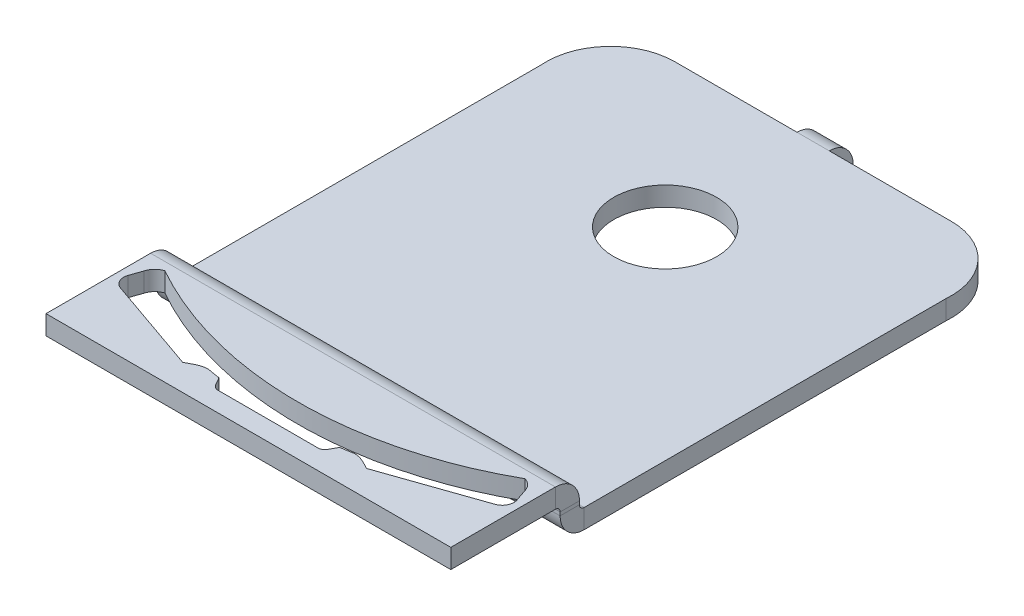
from build123d import *

# Parameters (mm, degrees)
BASE_FLANGE1_DEPTH           = 3
SKETCH2_R                    = 8
CUT_EXTRUDE1_DEPTH           = 73.112420355
EDGE_FLANGE1_STRIP_W         = 13.4732
EDGE_FLANGE1_STRIP_H         = 3
EDGE_FLANGE1_STRIP_CUT_DEPTH = 62.933077126
EDGE_FLANGE1_DEPTH           = 62.933077126
EDGE_FLANGE2_STRIP_W         = 13.4732
EDGE_FLANGE2_STRIP_H         = 3
EDGE_FLANGE2_STRIP_CUT_DEPTH = 62.933077126
EDGE_FLANGE2_DEPTH           = 62.933077126
CUT_EXTRUDE14_DEPTH          = 73.492766325
CUT_EXTRUDE15_DEPTH          = 73.492766325
CUT_EXTRUDE16_DEPTH          = 73.492766325
SKETCHED_START               = -2.498589927
SKETCHED_BEND2_DEPTH         = 5
SKETCHED_BEND2_2_DEPTH       = 5


# Read off the part's stored shape, not the designer's step: Sketched Bend2
# Sheet-metal steps are written as plain solids
with BuildPart() as part:
    # Sketch1 → Base-Flange1 (new body)
    with BuildSketch(Plane(origin=(0, 0, 0), x_dir=(1, 0, 0), z_dir=(0, 1, 0))):
        with BuildLine():
            Line((2.501410073, 64.8), (-2.498589927, 64.8))
            Line((-2.498589927, 64.8), (-2.498589927, 44.8))
            Line((-2.498589927, 44.8), (-21.498589927, 44.8))
            ThreePointArc((-21.498589927, 44.8), (-28.847059156, 41.582329983), (-31.466538563, 34))
            Line((-31.466538563, 34), (-31.466538563, -26))
            Line((-31.466538563, -26), (31.466538563, -26))
            Line((31.466538563, -26), (31.466538563, 34))
            ThreePointArc((31.466538563, 34), (28.848015597, 41.581293991), (21.501410073, 44.8))
            Line((21.501410073, 44.8), (2.501410073, 44.8))
            Line((2.501410073, 44.8), (2.501410073, 64.8))
        make_face()
    extrude(amount=-BASE_FLANGE1_DEPTH)

    # Sketch2 → Cut-Extrude1 (cut, through all)
    with BuildSketch(Plane(origin=(0, 0, 0), x_dir=(1, 0, 0), z_dir=(0, 1, 0))):
        with Locations(Location((0.000474376, 21.8, 0), (0, 0, 270))):
            Circle(SKETCH2_R)
    extrude(amount=-CUT_EXTRUDE1_DEPTH, mode=Mode.SUBTRACT)

    # Edge-Flange1 strip (across the edge) → Edge-Flange1 strip cut (cut)
    with BuildSketch(Plane(origin=(-31.466538563, 0, 26), x_dir=(0, 0, -1), z_dir=(1, 0, 0))):
        with Locations((-3, -1.5)):
            Rectangle(EDGE_FLANGE1_STRIP_W, EDGE_FLANGE1_STRIP_H)
    extrude(amount=EDGE_FLANGE1_STRIP_CUT_DEPTH, mode=Mode.SUBTRACT)

    # Edge-Flange1 section (across the edge) → Edge-Flange1 (add)
    with BuildSketch(Plane(origin=(-31.466538563, 0, 26), x_dir=(0, 0, -1), z_dir=(1, 0, 0))):
        with BuildLine():
            Line((0, 0.7366), (0, 2))
            Line((0, 2), (3, 2))
            Line((3, 2), (3, 0.7366))
            ThreePointArc((3, 0.7366), (3.215745145, 0.215745145), (3.7366, 0))
            Line((3.7366, 0), (3.7366, -3))
            ThreePointArc((3.7366, -3), (1.094424801, -1.905575199), (0, 0.7366))
        make_face()
    extrude(amount=EDGE_FLANGE1_DEPTH)

    # Edge-Flange2 strip (across the edge) → Edge-Flange2 strip cut (cut)
    with BuildSketch(Plane(origin=(31.466538563, 2, 26), x_dir=(0, -1, 0), z_dir=(-1, 0, 0))):
        with Locations((-6, -1.5)):
            Rectangle(EDGE_FLANGE2_STRIP_W, EDGE_FLANGE2_STRIP_H)
    extrude(amount=EDGE_FLANGE2_STRIP_CUT_DEPTH, mode=Mode.SUBTRACT)

    # Edge-Flange2 section (across the edge) → Edge-Flange2 (add)
    with BuildSketch(Plane(origin=(31.466538563, 2, 26), x_dir=(0, -1, 0), z_dir=(-1, 0, 0))):
        with BuildLine():
            Line((-3, 0.7366), (-3, 17))
            Line((-3, 17), (0, 17))
            Line((0, 17), (0, 0.7366))
            ThreePointArc((0, 0.7366), (0.215745145, 0.215745145), (0.7366, 0))
            Line((0.7366, 0), (0.7366, -3))
            ThreePointArc((0.7366, -3), (-1.905575199, -1.905575199), (-3, 0.7366))
        make_face()
    extrude(amount=EDGE_FLANGE2_DEPTH)

    # Sketch10 → Cut-Extrude14 (cut, through all)
    with BuildSketch(Plane(origin=(0, 5, 0), x_dir=(1, 0, 0), z_dir=(0, 1, 0))):
        with BuildLine():
            ThreePointArc((-27.999525624, -27.986488127), (-14.471973254, -33.456154948), (0, -35.319999998))
            ThreePointArc((0, -35.319999998), (14.472463109, -33.456275138), (28.000474376, -27.986488127))
            ThreePointArc((28.000474376, -27.986488127), (29.507543106, -29.356635577), (29.415737967, -31.391367011))
            ThreePointArc((29.415737967, -31.391367011), (26.522239798, -32.891637528), (23.552482739, -34.23465141))
            ThreePointArc((23.552482739, -34.23465141), (12.025251123, -37.723725926), (0.039934977, -38.908169509))
            ThreePointArc((0.039934977, -38.908169509), (-11.98559581, -37.731400069), (-23.551533984, -34.234651411))
            ThreePointArc((-23.551533984, -34.234651411), (-26.516212861, -32.894099815), (-29.404911166, -31.396828455))
            ThreePointArc((-29.404911166, -31.396828455), (-29.503369191, -29.361507737), (-27.999525624, -27.986488127))
        make_face()
    extrude(amount=-CUT_EXTRUDE14_DEPTH, mode=Mode.SUBTRACT)

    # Sketch12 → Cut-Extrude15 (cut, through all)
    with BuildSketch(Plane(origin=(0, 5, 0), x_dir=(1, 0, 0), z_dir=(0, 1, 0))):
        with BuildLine():
            add(Edge.make_bspline(
                [(-7.914237019, -39.945550294), (-8.841345223, -39.749796487), (-8.874121397, -38.753829984), (-9.426515507, -38.182603627)],
                knots=[0, 0, 0, 0, 0.911940572, 0.911940572, 0.911940572, 0.911940572], degree=3))
            Line((-7.914237019, -39.945550294), (0, -39.945550294))
            Line((0, -39.945550294), (0, -38.908175729))
            ThreePointArc((0, -38.908175729), (-4.727168745, -38.726119033), (-9.426515507, -38.182603627))
        make_face()
        with BuildLine():
            add(Edge.make_bspline(
                [(-9.426515507, -38.182603627), (-9.479856164, -38.127444478), (-9.538041922, -38.076245756), (-9.602345878, -38.030110388)],
                knots=[0.911940572, 0.911940572, 0.911940572, 0.911940572, 1, 1, 1, 1], degree=3))
            ThreePointArc((-9.426515507, -38.182603627), (-4.727168745, -38.726119033), (0, -38.908175729))
            Line((0, -38.908175729), (0, -38.030110388))
            Line((0, -38.030110388), (-9.602345878, -38.030110388))
        make_face()
        with BuildLine():
            Line((0, -38.030110388), (0, -38.908175729))
            ThreePointArc((0, -38.908175729), (0.019967489, -38.908175848), (0.039934977, -38.908169509))
            ThreePointArc((0.039934977, -38.908169509), (4.746985688, -38.724674098), (9.42633967, -38.182785492))
            add(Edge.make_bspline(
                [(9.42633967, -38.182785492), (9.479728286, -38.127557013), (9.537971255, -38.076296456), (9.602345878, -38.030110388)],
                knots=[0.9118438, 0.9118438, 0.9118438, 0.9118438, 1, 1, 1, 1], degree=3))
            Line((9.602345878, -38.030110388), (0, -38.030110388))
        make_face()
        with BuildLine():
            Line((0, -38.908175729), (0, -39.945550294))
            Line((0, -39.945550294), (7.914237019, -39.945550294))
            add(Edge.make_bspline(
                [(7.914237019, -39.945550294), (8.841246841, -39.74981726), (8.874114431, -38.754041352), (9.42633967, -38.182785492)],
                knots=[0, 0, 0, 0, 0.9118438, 0.9118438, 0.9118438, 0.9118438], degree=3))
            ThreePointArc((9.42633967, -38.182785492), (4.746985688, -38.724674098), (0.039934977, -38.908169509))
            ThreePointArc((0.039934977, -38.908169509), (0.019967489, -38.908175848), (0, -38.908175729))
        make_face()
    extrude(amount=-CUT_EXTRUDE15_DEPTH, mode=Mode.SUBTRACT)

    # Sketch13 → Cut-Extrude16 (cut, through all)
    with BuildSketch(Plane(origin=(0, 5, 0), x_dir=(1, 0, 0), z_dir=(0, 1, 0))):
        with BuildLine():
            Line((-29.503369191, -29.361507737), (-30.236500006, -31.46681125))
            ThreePointArc((-30.236500006, -31.46681125), (-30.1571885, -32.842186741), (-29.128569459, -33.758642374))
            Line((-29.128569459, -33.758642374), (-14.274829355, -38.931167152))
            add(Edge.make_bspline(
                [(-14.274829355, -38.931167152), (-13.356001391, -38.419364556), (-12.413528872, -37.83920993), (-11.311548038, -37.858876708)],
                knots=[0, 0, 0, 0, 1, 1, 1, 1], degree=3))
            Line((-11.311548038, -37.858876708), (-10.639965658, -35.930319464))
            Line((-10.639965658, -35.930319464), (-29.503369191, -29.361507737))
        make_face()
        with BuildLine():
            Line((10.639965658, -35.930319464), (11.311548038, -37.858876708))
            add(Edge.make_bspline(
                [(14.274829355, -38.931167152), (13.356001391, -38.419364556), (12.413528872, -37.83920993), (11.311548038, -37.858876708)],
                knots=[0, 0, 0, 0, 1, 1, 1, 1], degree=3))
            Line((14.274829355, -38.931167152), (29.128569459, -33.758642374))
            ThreePointArc((29.128569459, -33.758642374), (30.1571885, -32.842186741), (30.236500006, -31.46681125))
            Line((30.236500006, -31.46681125), (29.503369191, -29.361507737))
            Line((29.503369191, -29.361507737), (10.639965658, -35.930319464))
        make_face()
    extrude(amount=-CUT_EXTRUDE16_DEPTH, mode=Mode.SUBTRACT)

    # Sketched Bend2 outline → Sketched Bend2 (cut)
    with BuildSketch(Plane.YZ.offset(SKETCHED_START)):
        with BuildLine():
            ThreePointArc((0, -44.8), (-0.845704021, -47.167467001), (-3, -48.463277222))
            Line((-3, -48.463277222), (-3, -64.8))
            Line((-3, -64.8), (0, -64.8))
            Line((0, -64.8), (0, -44.8))
        make_face()
    extrude(amount=SKETCHED_BEND2_DEPTH, mode=Mode.SUBTRACT)

    # Sketched Bend2 2 outline → Sketched Bend2 2 (add)
    with BuildSketch(Plane.YZ.offset(SKETCHED_START)):
        with BuildLine():
            ThreePointArc((-3, -44.8), (-3.215745145, -45.320854855), (-3.7366, -45.5366))
            Line((-3.7366, -45.5366), (-20.223356935, -45.5366))
            Line((-20.223356935, -45.5366), (-20.223356935, -48.5366))
            Line((-20.223356935, -48.5366), (-3.7366, -48.5366))
            ThreePointArc((-3.7366, -48.5366), (-3.36647982, -48.518224121), (-3, -48.463277222))
            Line((-3, -48.463277222), (-3, -44.8))
        make_face()
    extrude(amount=SKETCHED_BEND2_2_DEPTH)


solid = part.part
